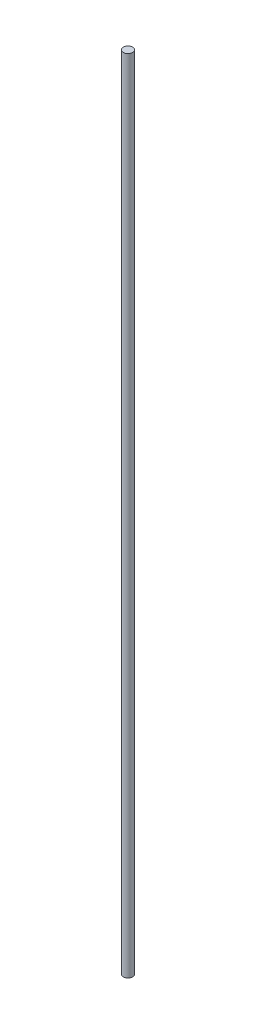
from build123d import *

# Parameters (mm, degrees)
SKETCH1_R           = 2
BOSS_EXTRUDE1_DEPTH = 344


with BuildPart() as part:
    # Sketch1 → Boss-Extrude1 (new body)
    with BuildSketch(Plane(origin=(0, 0, 0), x_dir=(1, 0, 0), z_dir=(0, 1, 0))):
        Circle(SKETCH1_R)
    extrude(amount=BOSS_EXTRUDE1_DEPTH)


solid = part.part
